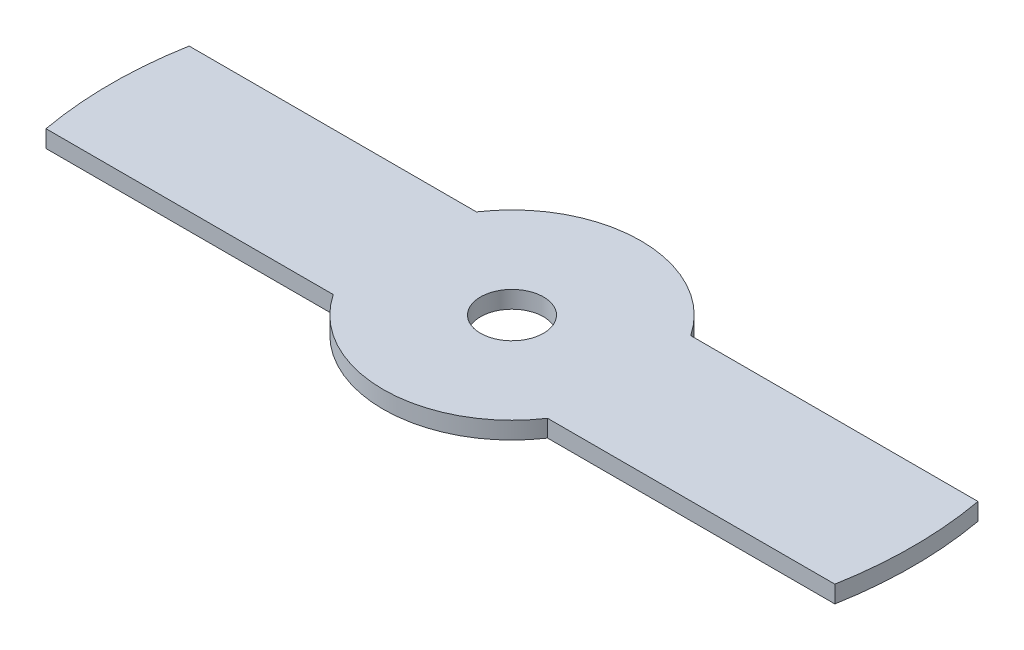
from build123d import *

# Parameters (mm, degrees)
CROQUIS1_R              = 5.5
SALIENTE_EXTRUIR1_DEPTH = 3


with BuildPart() as part:
    # Croquis1 → Saliente-Extruir1 (new body)
    with BuildSketch(Plane(origin=(0, 0, 0), x_dir=(1, 0, 0), z_dir=(0, 1, 0))):
        with BuildLine():
            Line((-18.708286934, 12.5), (-68.87488657, 12.5))
            ThreePointArc((-68.87488657, 12.5), (-70, 0), (-68.87488657, -12.5))
            Line((-68.87488657, -12.5), (-18.708286934, -12.5))
            ThreePointArc((-18.708286934, -12.5), (0, -22.5), (18.708286934, -12.5))
            Line((18.708286934, -12.5), (68.87488657, -12.5))
            ThreePointArc((68.87488657, -12.5), (70, 0), (68.87488657, 12.5))
            Line((68.87488657, 12.5), (18.708286934, 12.5))
            ThreePointArc((18.708286934, 12.5), (0, 22.5), (-18.708286934, 12.5))
        make_face()
        Circle(CROQUIS1_R, mode=Mode.SUBTRACT)
    extrude(amount=SALIENTE_EXTRUIR1_DEPTH)


solid = part.part
